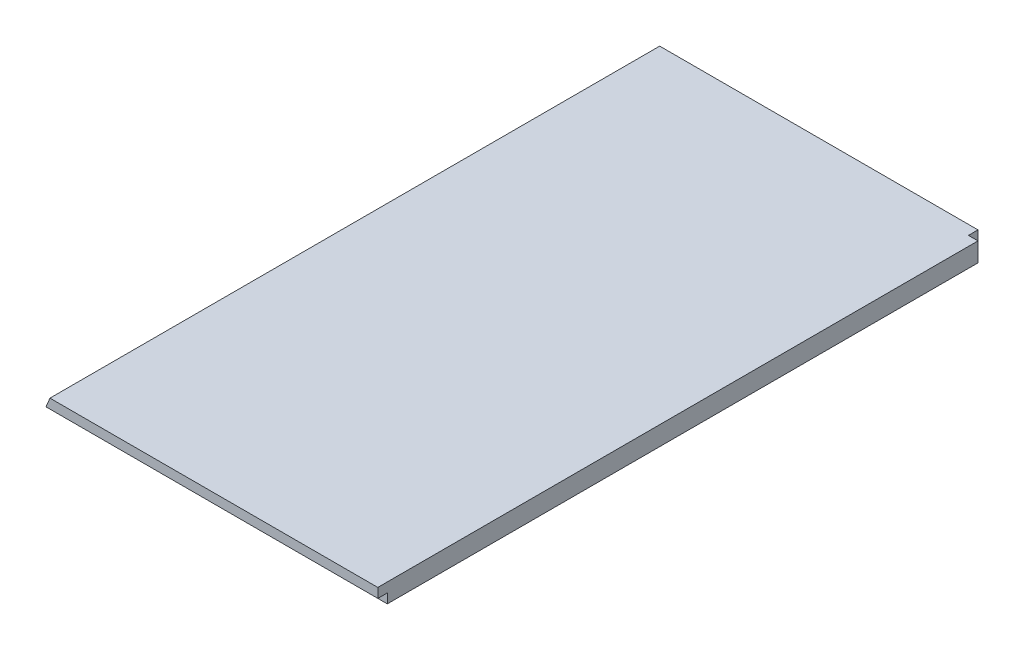
from build123d import *

# Parameters (mm, degrees)
BOSS_EXTRUDE1_DEPTH = 406.4
SKETCH2_W           = 223.774
SKETCH2_H           = 6.35
CUT_EXTRUDE1_DEPTH  = 6.35
SKETCH3_W           = 223.774
SKETCH3_H           = 6.35
CUT_EXTRUDE2_DEPTH  = 6.35
SKETCH4_W           = 6.35
SKETCH4_H           = 6.35
CUT_EXTRUDE3_DEPTH  = 465.108880626


with BuildPart() as part:
    # Sketch1 → Boss-Extrude1 (new body)
    with BuildSketch(Plane.XY):
        Polygon((0, 0), (5.260512242, 12.7), (223.774, 12.7), (223.774, 0), align=None)
    extrude(amount=BOSS_EXTRUDE1_DEPTH)

    # Sketch2 → Cut-Extrude1 (cut)
    with BuildSketch(Plane.XZ):
        with Locations((111.887, 3.175)):
            Rectangle(SKETCH2_W, SKETCH2_H)
    extrude(amount=-CUT_EXTRUDE1_DEPTH, mode=Mode.SUBTRACT)

    # Sketch3 → Cut-Extrude2 (cut)
    with BuildSketch(Plane.XZ):
        with Locations((111.887, 403.225)):
            Rectangle(SKETCH3_W, SKETCH3_H)
    extrude(amount=-CUT_EXTRUDE2_DEPTH, mode=Mode.SUBTRACT)

    # Sketch4 → Cut-Extrude3 (cut, through all)
    with BuildSketch(Plane.XZ):
        with Locations((220.599, 3.175)):
            Rectangle(SKETCH4_W, SKETCH4_H)
    extrude(amount=-CUT_EXTRUDE3_DEPTH, mode=Mode.SUBTRACT)


solid = part.part
